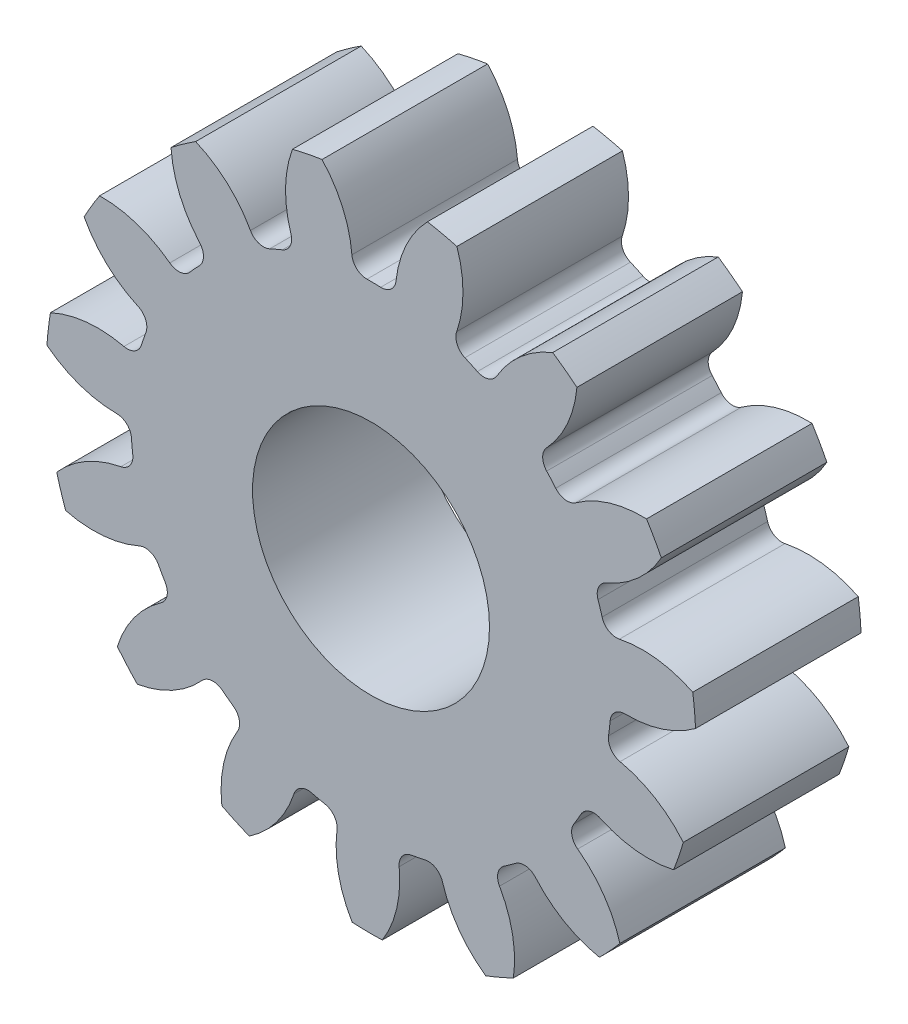
from build123d import *

# Parameters (mm, degrees)
SKETCH3_R         = 21.59
GEARBODY_DEPTH    = 11
TOOTHCUT_DEPTH    = 33.453908855
CIRPATTERN1_COUNT = 15
BOREDIA_R         = 7.874
BORE_DEPTH        = 12700


with BuildPart() as part:
    # Sketch3 → gearBody (new body)
    with BuildSketch(Plane.XY):
        Circle(SKETCH3_R)
    extrude(amount=GEARBODY_DEPTH)

    # Sketch2 → toothCut (cut, through all)
    with BuildSketch(Plane.XY):
        with BuildLine():
            ThreePointArc((15.783846764, -2.304552616), (15.843293638, -1.852249483), (15.889781974, -1.39843136))
            ThreePointArc((15.889781974, -1.39843136), (16.213055843, -0.751556907), (16.890861518, -0.499501321))
            ThreePointArc((16.890861518, -0.499501321), (20.504912911, 0.340315353), (23.283949955, 2.798691365))
            ThreePointArc((23.283949955, 2.798691365), (23.292901215, -2.723187818), (22.010467945, -8.09409042))
            ThreePointArc((22.010467945, -8.09409042), (19.873444675, -5.060974685), (16.550574786, -3.410158156))
            ThreePointArc((16.550574786, -3.410158156), (15.949189176, -3.008551507), (15.783846764, -2.304552616))
        make_face()
    toothcut = extrude(amount=TOOTHCUT_DEPTH, mode=Mode.SUBTRACT)

    # CirPattern1: toothCut ×15 about axis
    cirpattern1_axis = Axis((0, 0, 11), (0, 0, -1))
    for i in range(1, CIRPATTERN1_COUNT):
        add(toothcut.rotate(cirpattern1_axis, i * 360 / CIRPATTERN1_COUNT), mode=Mode.SUBTRACT)

    # boreDia → bore (cut, symmetric)
    with BuildSketch(Plane.XY):
        Circle(BOREDIA_R)
    extrude(amount=BORE_DEPTH, both=True, mode=Mode.SUBTRACT)


solid = part.part
